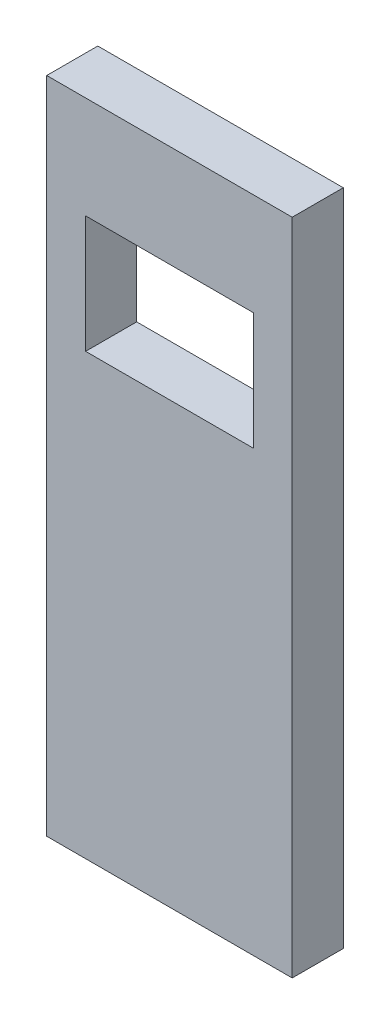
from build123d import *

# Parameters (mm, degrees)
SKETCH1_W           = 17.08
SKETCH1_H           = 11.95
BOSS_EXTRUDE1_DEPTH = 2.6


with BuildPart() as part:
    # Sketch1 → Boss-Extrude1 (new, symmetric)
    with BuildSketch(Plane.XY):
        Polygon((0, 67.1), (0, 44.75), (0, 39.55), (0, 27.6), (0, 22.4), (0, 0), (25, 0), (25, 22.4), (25, 27.6), (25, 39.55), (25, 44.75), (25, 67.1), align=None)
        with Locations((12.5, 50.725)):
            Rectangle(SKETCH1_W, SKETCH1_H, mode=Mode.SUBTRACT)
    extrude(amount=BOSS_EXTRUDE1_DEPTH, both=True)


solid = part.part
